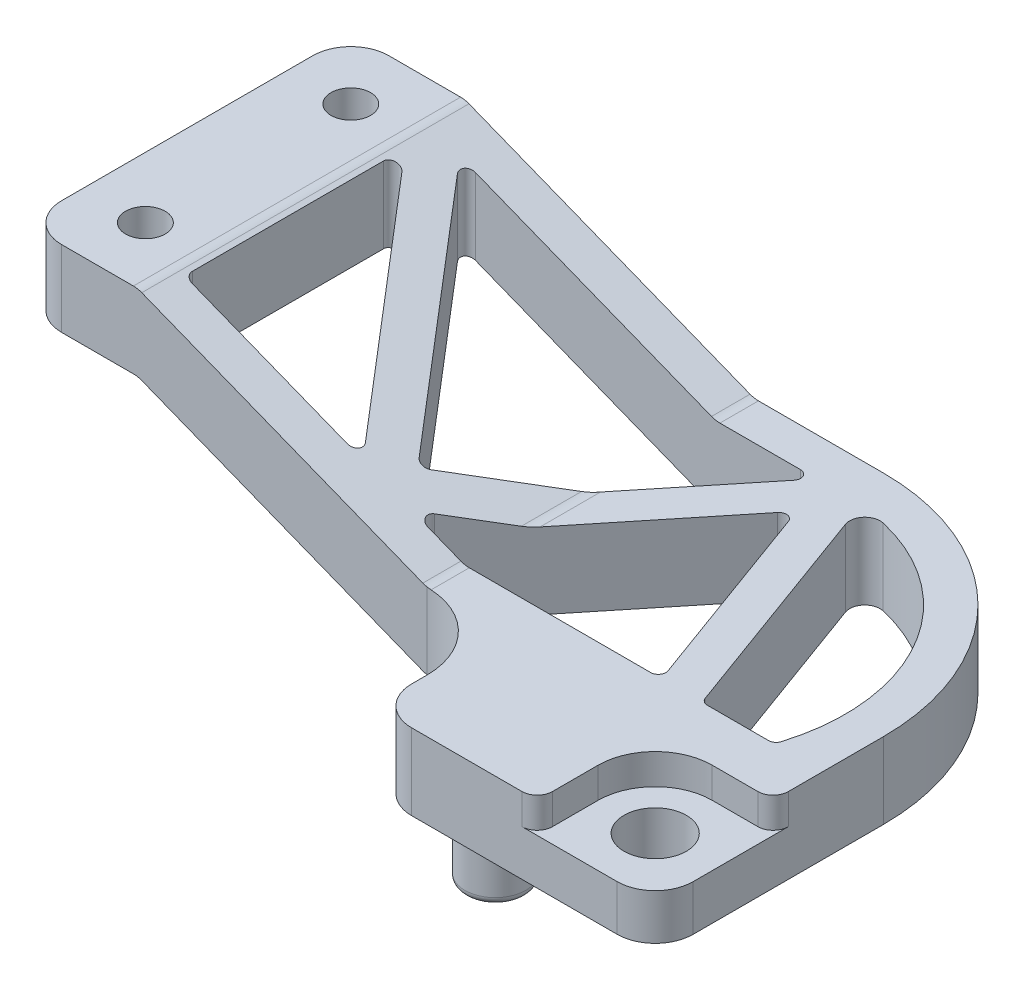
from build123d import *

# Parameters (mm, degrees)
SKETCH1_R           = 4.1
SKETCH1_R_2         = 4
SKETCH1_R_3         = 2.6
BOSS_EXTRUDE1_DEPTH = 10
CUT_EXTRUDE1_START  = -4
CUT_EXTRUDE1_DEPTH  = 4
FILLET1_R           = 2
BOSS_EXTRUDE2_START = -20
SKETCH3_R           = 4
BOSS_EXTRUDE2_DEPTH = 20
FILLET2_R           = 1
SKETCH4_R           = 2.6
BOSS_EXTRUDE3_DEPTH = 15
CUT_EXTRUDE2_REACH  = 78.959
FILLET3_R           = 3
CUT_EXTRUDE3_DEPTH  = 6


with BuildPart() as part:
    # Sketch1 → Boss-Extrude1 (new body)
    with BuildSketch(Plane(origin=(0, 0, 0), x_dir=(1, 0, 0), z_dir=(0, 1, 0))):
        with BuildLine():
            Line((11.273947383, 72.313413723), (4.792068361, 72.313413723))
            Line((4.792068361, 72.313413723), (-53.726052617, 72.313413723))
            ThreePointArc((-53.726052617, 72.313413723), (-57.261586523, 70.848947629), (-58.726052617, 67.313413723))
            Line((-58.726052617, 67.313413723), (-58.726052617, 34.313413723))
            ThreePointArc((-58.726052617, 34.313413723), (-57.261586523, 30.777879817), (-53.726052617, 29.313413723))
            Line((-53.726052617, 29.313413723), (-5.726052617, 29.313413723))
            ThreePointArc((-5.726052617, 29.313413723), (1.345015195, 26.384481534), (4.273947383, 19.313413723))
            Line((4.273947383, 19.313413723), (4.273947383, 17.313413723))
            ThreePointArc((4.273947383, 17.313413723), (5.738413477, 13.777879817), (9.273947383, 12.313413723))
            Line((9.273947383, 12.313413723), (36.273947383, 12.313413723))
            ThreePointArc((36.273947383, 12.313413723), (39.809481289, 13.777879817), (41.273947383, 17.313413723))
            Line((41.273947383, 17.313413723), (41.273947383, 42.313413723))
            ThreePointArc((41.273947383, 42.313413723), (32.487150819, 63.526617158), (11.273947383, 72.313413723))
        make_face()
        with Locations((33.273947383, 20.313413723)):
            Circle(SKETCH1_R, mode=Mode.SUBTRACT)
        with Locations((12.273947383, 20.313413723)):
            Circle(SKETCH1_R_2, mode=Mode.SUBTRACT)
        with Locations((-50.726052617, 64.313413723)):
            Circle(SKETCH1_R_3, mode=Mode.SUBTRACT)
        with Locations((-50.726052617, 37.313413723)):
            Circle(SKETCH1_R_3, mode=Mode.SUBTRACT)
        with BuildLine():
            Line((34.171420048, 34.313413723), (26.134777641, 34.313413723))
            ThreePointArc((26.134777641, 34.313413723), (25.561526201, 34.49403421), (25.19535667, 34.97064815))
            Line((25.19535667, 34.97064815), (14.615821544, 63.966084002))
            ThreePointArc((14.615821544, 63.966084002), (14.998488248, 65.980552022), (16.952543045, 66.601989919))
            ThreePointArc((16.952543045, 66.601989919), (32.892900514, 54.755368869), (35.127730175, 35.021059585))
            ThreePointArc((35.127730175, 35.021059585), (34.766250218, 34.509562325), (34.171420048, 34.313413723))
        make_face(mode=Mode.SUBTRACT)
        with BuildLine():
            Line((-42.557674575, 35.313413723), (-42.557674575, 60.452375226))
            ThreePointArc((-42.557674575, 60.452375226), (-41.891342574, 61.395065879), (-40.780343242, 61.081466633))
            Line((-40.780343242, 61.081466633), (-20.435473581, 35.94250513))
            ThreePointArc((-20.435473581, 35.94250513), (-20.310283056, 34.882769674), (-21.212804914, 34.313413723))
            Line((-21.212804914, 34.313413723), (-41.557674575, 34.313413723))
            ThreePointArc((-41.557674575, 34.313413723), (-42.264781356, 34.606306941), (-42.557674575, 35.313413723))
        make_face(mode=Mode.SUBTRACT)
        with BuildLine():
            Line((-37.245793747, 67.251595954), (5.443945576, 67.251595954))
            ThreePointArc((5.443945576, 67.251595954), (6.346467434, 66.682240002), (6.221276909, 65.622504547))
            Line((6.221276909, 65.622504547), (-15.123592752, 39.247901728))
            ThreePointArc((-15.123592752, 39.247901728), (-15.900924085, 38.876993135), (-16.678255419, 39.247901728))
            Line((-16.678255419, 39.247901728), (-38.02312508, 65.622504547))
            ThreePointArc((-38.02312508, 65.622504547), (-38.148315604, 66.682240002), (-37.245793747, 67.251595954))
        make_face(mode=Mode.SUBTRACT)
        with BuildLine():
            Line((19.622800135, 35.656179295), (10.526467022, 60.58658882))
            ThreePointArc((10.526467022, 60.58658882), (9.751557094, 61.230198488), (8.809714717, 60.872914654))
            Line((8.809714717, 60.872914654), (-11.36637459, 35.94250513))
            ThreePointArc((-11.36637459, 35.94250513), (-11.491565114, 34.882769674), (-10.589043257, 34.313413723))
            Line((-10.589043257, 34.313413723), (18.683379163, 34.313413723))
            ThreePointArc((18.683379163, 34.313413723), (19.502758676, 34.740162282), (19.622800135, 35.656179295))
        make_face(mode=Mode.SUBTRACT)
    extrude(amount=BOSS_EXTRUDE1_DEPTH)

    # Sketch2 → Cut-Extrude1 (cut)
    with BuildSketch(Plane(origin=(0, 10, 0), x_dir=(1, 0, 0), z_dir=(0, 1, 0)).offset(CUT_EXTRUDE1_START)):
        with BuildLine():
            Line((33.273947383, 27.813413723), (41.273947383, 27.813413723))
            Line((41.273947383, 27.813413723), (41.273947383, 17.313413723))
            ThreePointArc((41.273947383, 17.313413723), (39.809481289, 13.777879817), (36.273947383, 12.313413723))
            Line((36.273947383, 12.313413723), (25.773947383, 12.313413723))
            Line((25.773947383, 12.313413723), (25.773947383, 20.313413723))
            ThreePointArc((25.773947383, 20.313413723), (27.970646524, 25.616714582), (33.273947383, 27.813413723))
        make_face()
    extrude(amount=CUT_EXTRUDE1_DEPTH, mode=Mode.SUBTRACT)

    # Fillet1
    fillet1_edges = [part.edges().sort_by_distance(p)[0] for p in [
        (41.273947383, 8, -27.813413723),
        (25.773947383, 8, -12.313413723),
    ]]
    fillet(fillet1_edges, radius=FILLET1_R)

    # Sketch3 → Boss-Extrude2 (add)
    with BuildSketch(Plane(origin=(0, 10, 0), x_dir=(1, 0, 0), z_dir=(0, 1, 0)).offset(BOSS_EXTRUDE2_START)):
        with Locations((12.273947383, 20.313413723)):
            Circle(SKETCH3_R)
    extrude(amount=BOSS_EXTRUDE2_DEPTH)

    # Fillet2
    fillet2_edges = [part.edges().sort_by_distance(p)[0] for p in [
        (8.273947383, -10, -20.313413723),
        (8.273947383, 0, -20.313413723),
    ]]
    fillet(fillet2_edges, radius=FILLET2_R)

    # Sketch4 → Boss-Extrude3 (add)
    with BuildSketch(Plane(origin=(0, 10, 0), x_dir=(1, 0, 0), z_dir=(0, 1, 0))):
        with BuildLine():
            Line((-58.726052617, 67.313413723), (-58.726052617, 34.313413723))
            ThreePointArc((-58.726052617, 34.313413723), (-57.261586523, 30.777879817), (-53.726052617, 29.313413723))
            Line((-53.726052617, 29.313413723), (-5.726052617, 29.313413723))
            Line((-5.726052617, 29.313413723), (-5.726052617, 34.313413723))
            Line((-5.726052617, 34.313413723), (-10.589043257, 34.313413723))
            ThreePointArc((-10.589043257, 34.313413723), (-11.491565114, 34.882769674), (-11.36637459, 35.94250513))
            Line((-11.36637459, 35.94250513), (-5.726052617, 42.91191999))
            Line((-5.726052617, 42.91191999), (-5.726052617, 50.813413723))
            Line((-5.726052617, 50.813413723), (-15.123592752, 39.247901728))
            ThreePointArc((-15.123592752, 39.247901728), (-15.900924085, 38.876993135), (-16.678255419, 39.247901728))
            Line((-16.678255419, 39.247901728), (-38.02312508, 65.622504547))
            ThreePointArc((-38.02312508, 65.622504547), (-38.148315604, 66.682240002), (-37.245793747, 67.251595954))
            Line((-37.245793747, 67.251595954), (-5.726052617, 67.251595954))
            Line((-5.726052617, 67.251595954), (-5.726052617, 72.313413723))
            Line((-5.726052617, 72.313413723), (-53.726052617, 72.313413723))
            ThreePointArc((-53.726052617, 72.313413723), (-57.261586523, 70.848947629), (-58.726052617, 67.313413723))
        make_face()
        with Locations((-50.726052617, 64.313413723)):
            Circle(SKETCH4_R, mode=Mode.SUBTRACT)
        with Locations((-50.726052617, 37.313413723)):
            Circle(SKETCH4_R, mode=Mode.SUBTRACT)
        with BuildLine():
            Line((-40.780343242, 61.081466633), (-20.435473581, 35.94250513))
            ThreePointArc((-20.435473581, 35.94250513), (-20.310283056, 34.882769674), (-21.212804914, 34.313413723))
            Line((-21.212804914, 34.313413723), (-41.557674575, 34.313413723))
            ThreePointArc((-41.557674575, 34.313413723), (-42.264781356, 34.606306941), (-42.557674575, 35.313413723))
            Line((-42.557674575, 35.313413723), (-42.557674575, 60.452375226))
            ThreePointArc((-42.557674575, 60.452375226), (-41.891342574, 61.395065879), (-40.780343242, 61.081466633))
        make_face(mode=Mode.SUBTRACT)
    extrude(amount=BOSS_EXTRUDE3_DEPTH)

    # Sketch5 → Cut-Extrude2 (cut, up to next)
    with BuildSketch(Plane.XY.offset(-29.313413723), mode=Mode.PRIVATE) as cut_extrude2_sk1:
        Polygon((-5.726052617, 10), (-43.726052617, 25), (-5.726052617, 25), align=None)
    cut_extrude2_tool1 = extrude(cut_extrude2_sk1.sketch, amount=-CUT_EXTRUDE2_REACH, mode=Mode.PRIVATE) & part.part
    # Sketch5 → Cut-Extrude2 (cut, up to next)
    with BuildSketch(Plane.XY.offset(-29.313413723), mode=Mode.PRIVATE) as cut_extrude2_sk2:
        Polygon((-53.726052617, 15), (-43.726052617, 15), (-5.726052617, 0), (-60.945305148, 0), (-60.945305148, 15), align=None)
    cut_extrude2_tool2 = extrude(cut_extrude2_sk2.sketch, amount=-CUT_EXTRUDE2_REACH, mode=Mode.PRIVATE) & part.part
    add(cut_extrude2_tool1.solids().sort_by_distance((-18.392719, 20, -29.313414))[0], mode=Mode.SUBTRACT)
    add(cut_extrude2_tool2.solids().sort_by_distance((-41.1745, 6.188543, -29.313414))[0], mode=Mode.SUBTRACT)

    # Fillet3
    fillet3_edges = [part.edges().sort_by_distance(p)[0] for p in [
        (-5.726052617, 10, -31.813413723),
        (-5.726052617, 10, -46.862666856),
        (-5.726052617, 10, -69.782504838),
        (-43.726052617, 15, -50.813413723),
    ]]
    fillet(fillet3_edges, radius=FILLET3_R)
    fillet3_2_edges = [part.edges().sort_by_distance(p)[0] for p in [
        (-43.726052617, 25, -50.813413723),
        (-5.726052617, 0, -69.782504838),
        (-5.726052617, 0, -46.885905285),
        (-5.726052617, 0, -31.813413723),
    ]]
    fillet(fillet3_2_edges, radius=FILLET3_R)

    # Sketch6 → Cut-Extrude3 (cut)
    with BuildSketch(Plane(origin=(0, 15, 0), x_dir=(-1, 0, 0), z_dir=(0, -1, 0))):
        Polygon((54.800383951, 61.902364674), (54.85124801, 66.636363637), (50.776916675, 69.047412686), (46.651721283, 66.724462771), (46.600857225, 61.990463808), (50.675188559, 59.57941476), align=None)
        Polygon((54.801038143, 39.66614114), (50.726023668, 42.018818416), (46.651038143, 39.666090999), (46.651067091, 34.960686305), (50.726081566, 32.608009029), (54.801067091, 34.960736446), align=None)
    extrude(amount=-CUT_EXTRUDE3_DEPTH, mode=Mode.SUBTRACT)


solid = part.part
